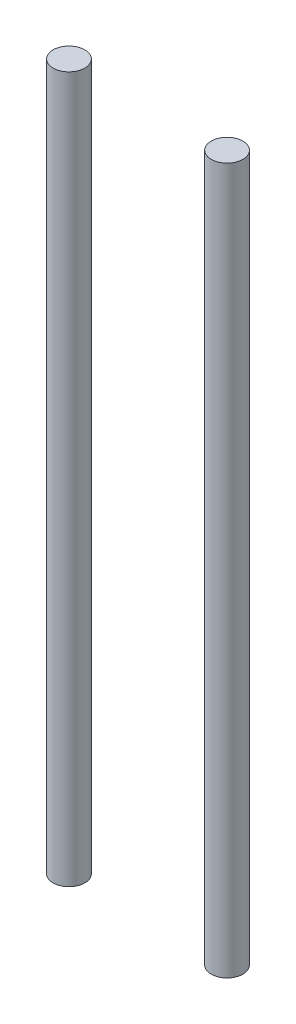
from build123d import *

# Parameters (mm, degrees)
BOSS_EXTRUDE1_DEPTH     = 20
SKETCH2_R               = 5.612511992
BOSS_EXTRUDE2_DEPTH     = 262
SKETCH3_R               = 3.25
CUT_EXTRUDE1_DEPTH      = 10
SKETCH4_R               = 3.25
CUT_EXTRUDE2_DEPTH      = 10
CUT_EXTRUDE4_DEPTH      = 154.130663161
CUT_EXTRUDE4_DEPTH_BACK = 154.130663161
SKETCH5_OUTSIDE_W       = 212.512
SKETCH5_OUTSIDE_H       = 324.512
SKETCH5_OUTSIDE_W_2     = 150
SKETCH5_OUTSIDE_H_2     = 250
CUT_EXTRUDE5_DEPTH      = 262.772802254
CUT_EXTRUDE5_DEPTH_BACK = 262.772802254
SKETCH7_W               = 81.108054856
SKETCH7_H               = 65.674538345
SKETCH7_W_2             = 53.864577775
SKETCH7_H_2             = 60.748947969


with BuildPart() as part:
    # Sketch1 → Boss-Extrude1 (new body)
    with BuildSketch(Plane.XY):
        Polygon((-75, -125), (-75, 125), (-75, 130), (-63.356925632, 130), (75, 130), (75, 125), (75, -125), (75, -130), (-75, -130), align=None)
        Polygon((-55, -105), (-55, 105), (-55, 125), (55, 125), (55, 105), (55, -105), (55, -125), (-55, -125), align=None, mode=Mode.SUBTRACT)
    extrude(amount=BOSS_EXTRUDE1_DEPTH)

    # Sketch2 → Boss-Extrude2 (add)
    with BuildSketch(Plane.XZ.offset(130)):
        with Locations((-28, 10)):
            Circle(SKETCH2_R)
        with Locations((28, 10)):
            Circle(SKETCH2_R)
    extrude(amount=-BOSS_EXTRUDE2_DEPTH)

    # Sketch3 → Cut-Extrude1 (cut)
    with BuildSketch(Plane.XZ.offset(-125)):
        with Locations((-44.25, 10)):
            Circle(SKETCH3_R)
        with Locations((-11.75, 10)):
            Circle(SKETCH3_R)
        with Locations((11.75, 10)):
            Circle(SKETCH3_R)
        with Locations((44.25, 10)):
            Circle(SKETCH3_R)
    extrude(amount=-CUT_EXTRUDE1_DEPTH, mode=Mode.SUBTRACT)

    # Sketch4 → Cut-Extrude2 (cut)
    with BuildSketch(Plane.XZ.offset(130)):
        with Locations((-44.25, 10)):
            Circle(SKETCH4_R)
        with Locations((-11.75, 10)):
            Circle(SKETCH4_R)
        with Locations((11.75, 10)):
            Circle(SKETCH4_R)
        with Locations((44.25, 10)):
            Circle(SKETCH4_R)
    extrude(amount=-CUT_EXTRUDE2_DEPTH, mode=Mode.SUBTRACT)

    # Sketch5 outside → Cut-Extrude4 (cut, two sides: drawn at the far end of the back side and taken through both)
    with BuildSketch(Plane(origin=(0, 0, 0), x_dir=(-1, 0, 0), z_dir=(0, 0, -1)).offset(-CUT_EXTRUDE4_DEPTH_BACK)):
        with Locations((0, 1)):
            Rectangle(SKETCH5_OUTSIDE_W, SKETCH5_OUTSIDE_H)
        Rectangle(SKETCH5_OUTSIDE_W_2, SKETCH5_OUTSIDE_H_2, mode=Mode.SUBTRACT)
    extrude(amount=CUT_EXTRUDE4_DEPTH + CUT_EXTRUDE4_DEPTH_BACK, mode=Mode.SUBTRACT)


with BuildPart() as cut_extrude4_piece_1:
    # of the separate pieces the step leaves, piece 1, a body of its own (cut_extrude4_pieces)
    add(part.part.solids().sort_by_distance((-75, 125, 0))[0])


with BuildPart() as cut_extrude4_piece_2:
    # of the separate pieces the step leaves, piece 2, a body of its own (cut_extrude4_pieces)
    add(part.part.solids().sort_by_distance((55, 125, 0))[0])


with BuildPart() as cut_extrude4_piece_3:
    # of the separate pieces the step leaves, piece 3, a body of its own (cut_extrude4_pieces)
    add(part.part.solids().sort_by_distance((33.612511992, -125, 10))[0])


with BuildPart() as cut_extrude4_piece_4:
    # of the separate pieces the step leaves, piece 4, a body of its own (cut_extrude4_pieces)
    add(part.part.solids().sort_by_distance((-22.387488008, -125, 10))[0])


with BuildPart() as cut_extrude5_tool:
    # Sketch7 → Cut-Extrude5 (new, two sides: drawn at the far end of the back side and taken through both)
    with BuildSketch(Plane.XZ.offset(125).offset(-CUT_EXTRUDE5_DEPTH_BACK)):
        with Locations((-82.84178753, 23.620209086)):
            Rectangle(SKETCH7_W, SKETCH7_H)
        with Locations((65.42421095, 13.93321468)):
            Rectangle(SKETCH7_W_2, SKETCH7_H_2)
    extrude(amount=CUT_EXTRUDE5_DEPTH + CUT_EXTRUDE5_DEPTH_BACK)


with BuildPart() as cut_extrude4_piece_1_1:
    add(cut_extrude4_piece_1.part)

    # Cut-Extrude5: cut by cut_extrude5_tool
    add(cut_extrude5_tool.part, mode=Mode.SUBTRACT)


with BuildPart() as cut_extrude4_piece_2_1:
    add(cut_extrude4_piece_2.part)

    # Cut-Extrude5: cut by cut_extrude5_tool
    add(cut_extrude5_tool.part, mode=Mode.SUBTRACT)


solid = Compound([cut_extrude4_piece_3.part, cut_extrude4_piece_4.part])
